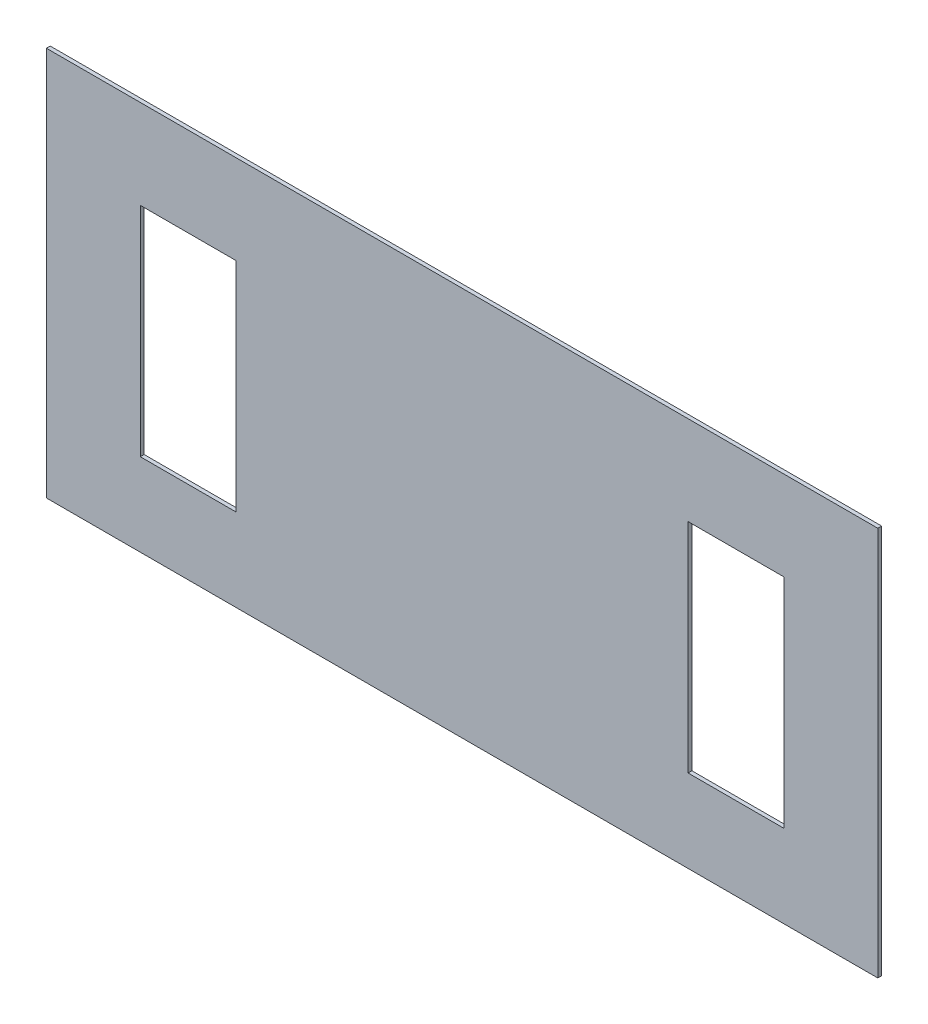
from build123d import *

# Parameters (mm, degrees)
SKETCH1_W           = 434
SKETCH1_H           = 203.336989564
BOSS_EXTRUDE1_DEPTH = 2
SKETCH2_W           = 50
SKETCH2_H           = 113.65363529
CUT_EXTRUDE1_DEPTH  = 435.934085853


with BuildPart() as part:
    # Sketch1 → Boss-Extrude1 (new body)
    with BuildSketch(Plane.XY):
        with Locations((205.475, 1.668494782)):
            Rectangle(SKETCH1_W, SKETCH1_H)
    extrude(amount=BOSS_EXTRUDE1_DEPTH)

    # Sketch2 → Cut-Extrude1 (cut, through all)
    with BuildSketch(Plane.XY.offset(2)):
        with Locations((62.491404548, 0)):
            Rectangle(SKETCH2_W, SKETCH2_H)
        with Locations((348.458595452, 0)):
            Rectangle(SKETCH2_W, SKETCH2_H)
    extrude(amount=-CUT_EXTRUDE1_DEPTH, mode=Mode.SUBTRACT)


solid = part.part
